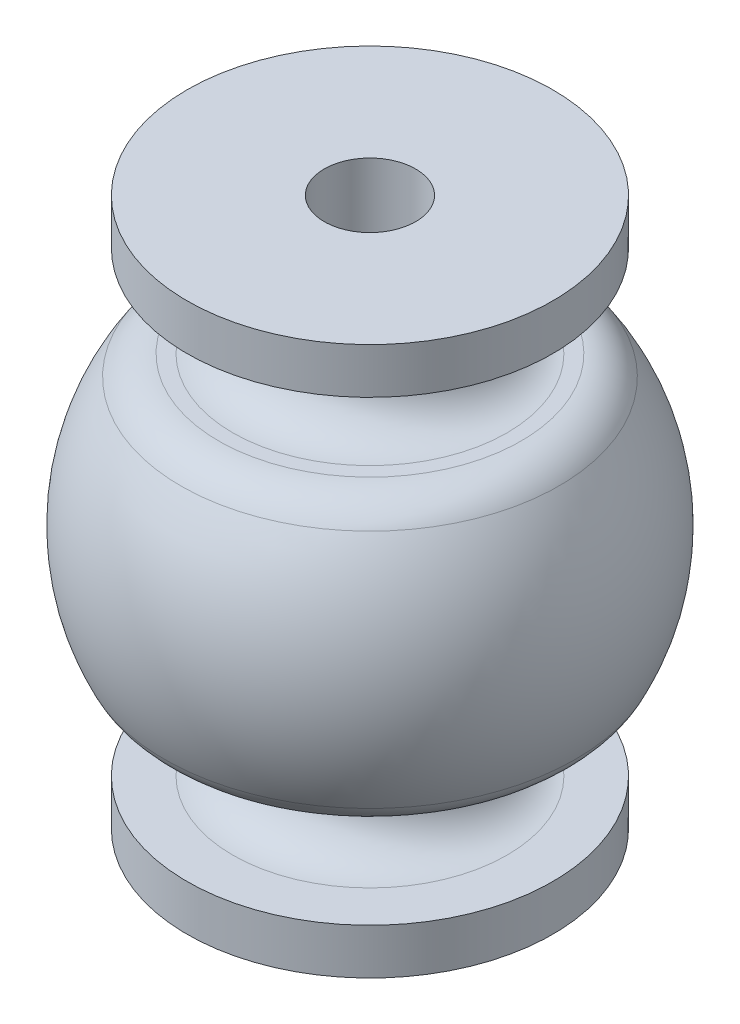
from build123d import *

# Parameters (mm, degrees)
FILLET1_R = 1


with BuildPart() as part:
    # Sketch1 → Revolve1 (revolve)
    with BuildSketch(Plane.XY):
        with BuildLine():
            Line((-1, 6), (-4, 6))
            Line((-4, 6), (-4, 5))
            Line((-4, 5), (-2, 5))
            Line((-2, 5), (-2, 3))
            Line((-2, 3), (-3.802039542, 3))
            ThreePointArc((-3.802039542, 3), (-4.990419802, 0.06214179), (-4.173997016, -3))
            Line((-4.173997016, -3), (-2, -3))
            Line((-2, -3), (-2, -5))
            Line((-2, -5), (-4, -5))
            Line((-4, -5), (-4, -6))
            Line((-4, -6), (-1, -6))
            Line((-1, -6), (-1, -5.146208353))
            ThreePointArc((-1, -5.146208353), (-1.27848834, -5.081012847), (-1.552793148, -5))
            Line((-1.552793148, -5), (-1, -5))
            Line((-1, -5), (-1, -2))
            Line((-1, -2), (-3.595524073, -2))
            ThreePointArc((-3.595524073, -2), (-3.989782487, 0.038490757), (-3.309072743, 2))
            Line((-3.309072743, 2), (-1, 2))
            Line((-1, 2), (-1, 6))
        make_face()
    revolve(axis=Axis((0, 6, 0), (0, -1, 0)))

    # Fillet1
    fillet1_edges = [part.edges().sort_by_distance(p)[0] for p in [
        (2, -5, 0),
        (2, -3, 0),
        (4.173997016, -3, 0),
        (3.802039542, 3, 0),
        (2, 3, 0),
        (2, 5, 0),
    ]]
    fillet(fillet1_edges, radius=FILLET1_R - 0.0001)  # a hair under: the kernel refuses the full size


solid = part.part
